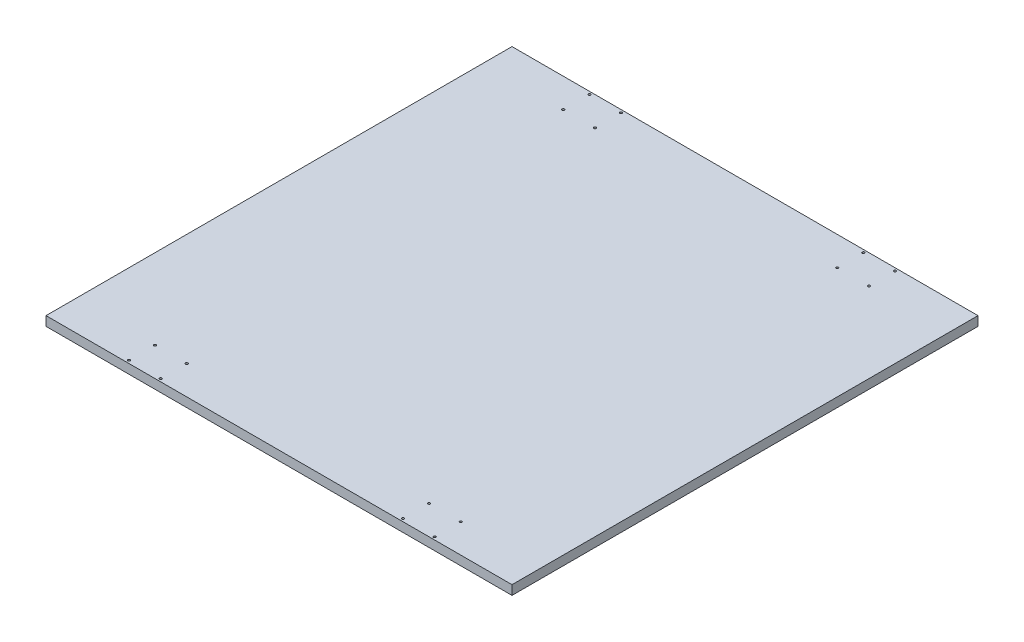
from build123d import *

# Parameters (mm, degrees)
SKETCH1_W                   = 500
SKETCH1_H                   = 500
BOSS_EXTRUDE1_DEPTH         = 10
TAP_DRILL_FOR_M3X0_5_TAP1_D = 2.5


with BuildPart() as part:
    # Sketch1 → Boss-Extrude1 (new body)
    with BuildSketch(Plane(origin=(0, 0, 0), x_dir=(1, 0, 0), z_dir=(0, 1, 0))):
        Rectangle(SKETCH1_W, SKETCH1_H)
    extrude(amount=BOSS_EXTRUDE1_DEPTH)

    # Tap Drill for M3x0.5 Tap1 (through all)
    with Locations(Plane(origin=(0, 10, 0), x_dir=(1, 0, 0), z_dir=(0, 1, 0))):
        with Locations((164, -219), (164, -247), (130, -247), (130, -219), (-130, -219), (-164, -219), (-164, -247), (-130, -247), (-130, 219), (-130, 247), (-164, 247), (-164, 219), (130, 247), (164, 247), (164, 219), (130, 219)):
            Hole(TAP_DRILL_FOR_M3X0_5_TAP1_D / 2)


solid = part.part
